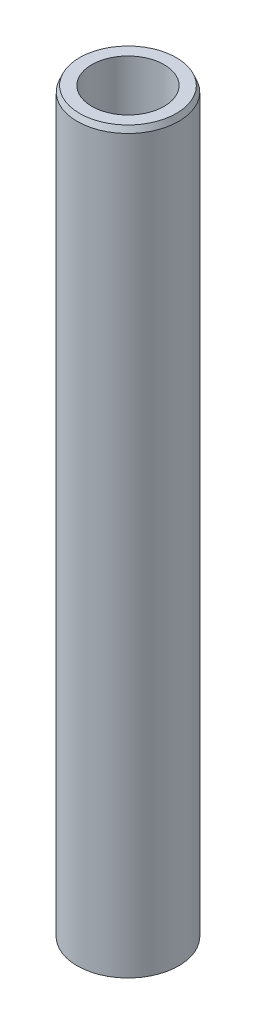
from build123d import *
from OCP.BRepFilletAPI import BRepFilletAPI_MakeChamfer

# Parameters (mm, degrees)
SKETCH1_R           = 35
BOSS_EXTRUDE1_DEPTH = 509.698656474
SKETCH2_R           = 24.932009224
CUT_EXTRUDE1_DEPTH  = 513.096397577
CHAMFER1_SIZE       = 3.920501376
CHAMFER1_SIZE2      = 1.655317951


with BuildPart() as part:
    # Sketch1 → Boss-Extrude1 (new body)
    with BuildSketch(Plane(origin=(0, 0, 0), x_dir=(1, 0, 0), z_dir=(0, 1, 0))):
        Circle(SKETCH1_R)
    extrude(amount=BOSS_EXTRUDE1_DEPTH)

    # Sketch2 → Cut-Extrude1 (cut, through all)
    with BuildSketch(Plane(origin=(0, 0, 0), x_dir=(1, 0, 0), z_dir=(0, 1, 0))):
        Circle(SKETCH2_R)
    extrude(amount=CUT_EXTRUDE1_DEPTH, mode=Mode.SUBTRACT)

    # Chamfer1: one chamfer whose edges measure the first distance from different faces: ONE call of the kernel's chamfer builder (chamfer() names one face for all edges)
    chamfer1_edges_1 = [part.edges().sort_by_distance(p)[0] for p in [
        (-35, 509.698656474, 0),
    ]]
    chamfer1_side_1 = [part.faces().sort_by_distance(p)[0] for p in [
        (-35, 254.849328237, 0),
    ]]
    chamfer1_edges_2 = [part.edges().sort_by_distance(p)[0] for p in [
        (-35, 0, 0),
    ]]
    chamfer1_side_2 = [part.faces().sort_by_distance(p)[0] for p in [
        (-34.010050506, 0, 0),
    ]]
    chamfer1 = BRepFilletAPI_MakeChamfer(part.part.solid().wrapped)
    for e in chamfer1_edges_1:
        chamfer1.Add(CHAMFER1_SIZE, CHAMFER1_SIZE2, e.wrapped, chamfer1_side_1[0].wrapped)  # the first distance lies on this face
    for e in chamfer1_edges_2:
        chamfer1.Add(CHAMFER1_SIZE, CHAMFER1_SIZE2, e.wrapped, chamfer1_side_2[0].wrapped)  # the first distance lies on this face
    add(Compound.cast(chamfer1.Shape()), mode=Mode.REPLACE)


solid = part.part
